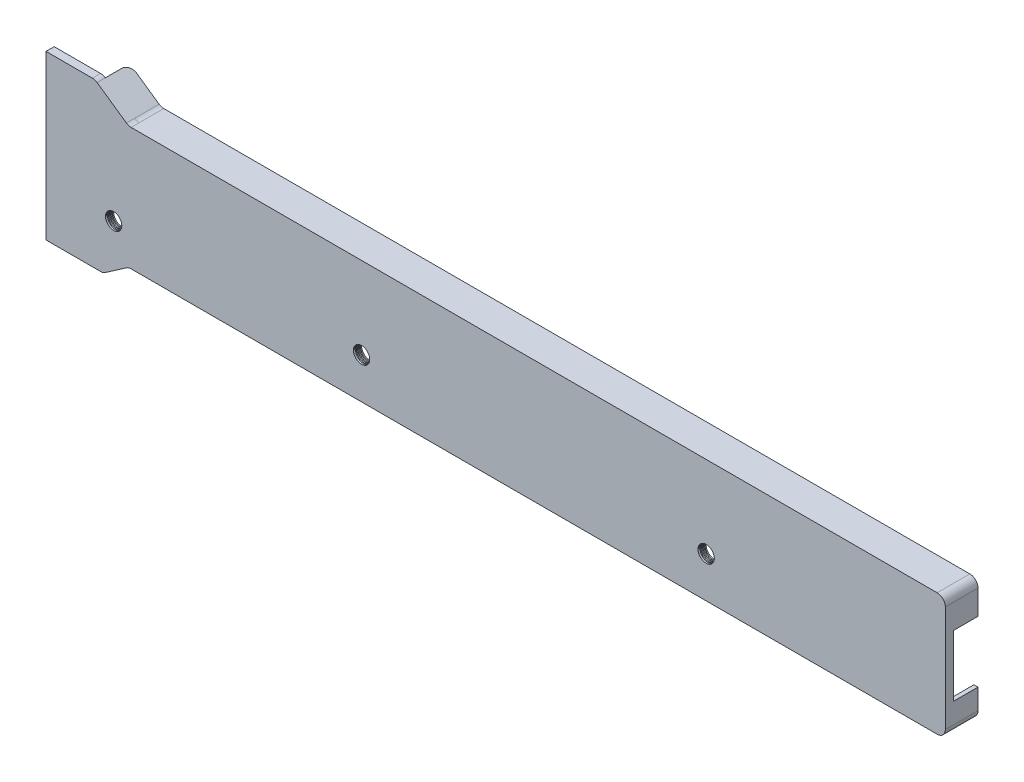
from build123d import *

# Parameters (mm, degrees)
SKETCH_1_W          = 200
SKETCH_1_H          = 30
EXTRUDE_1_DEPTH     = 2
EXTRUDE_2_DEPTH     = 2
FILLET_1_R          = 2
FILLET_2_R          = 2
FILLET_3_R          = 2
SKETCH_6_W          = 8.747928607
SKETCH_6_H          = 0.998948341
EXTRUDE_3_DEPTH     = 1
EXTRUDE_4_DEPTH     = 5
EXTRUDE_6_DEPTH     = 6
FILLET_4_R          = 2
SKETCH_10_W         = 199.373964303
SKETCH_10_H         = 0.996468734
EXTRUDE_7_DEPTH     = 7
SKETCH_11_W         = 6.303856782
SKETCH_11_H         = 2.016283396
EXTRUDE_8_DEPTH     = 1
EXTRUDE_9_DEPTH     = 6
EXTRUDE_10_DEPTH    = 4
SKETCH_14_W         = 5.003531266
SKETCH_14_H         = 7
EXTRUDE_11_DEPTH    = 1
SKETCH_17_W         = 6
SKETCH_17_H         = 6
EXTRUDE_12_DEPTH    = 1
FILLET_5_R          = 2
FILLET_6_R          = 2
SKETCH_18_R         = 2.000568808
CUT_EXTRUDE_1_DEPTH = 3
THREAD_1_PITCH      = 0.5
SKETCH_22_R         = 2.00056881
CUT_EXTRUDE_2_DEPTH = 3
THREAD_3_PITCH      = 0.5
THREAD_4_PITCH      = 0.5


# Read off the part's stored shape, not the designer's step: 填料-伸長6
with BuildPart() as part:
    # Sketch 1 → 填料-伸長1 (new body)
    with BuildSketch(Plane.XY):
        Rectangle(SKETCH_1_W, SKETCH_1_H)
    extrude(amount=EXTRUDE_1_DEPTH)

    # 草圖2 → 填料-伸長2 (add)
    with BuildSketch(Plane.XY):
        Polygon((-100, 15), (-108.215265162, 20.701703106), (-120.21070114, 20.701703106), (-120.21070114, -19.298296894), (-106.21070114, -19.298296894), (-100, -15), align=None)
    extrude(amount=EXTRUDE_2_DEPTH)

    # 圓角1
    fillet_1_edges = [part.edges().sort_by_distance(p)[0] for p in [
        (-100, 15, 1),
    ]]
    fillet(fillet_1_edges, radius=FILLET_1_R)

    # 圓角2
    fillet_2_edges = [part.edges().sort_by_distance(p)[0] for p in [
        (-108.215265162, 20.701703106, 1),
    ]]
    fillet(fillet_2_edges, radius=FILLET_2_R)

    # 圓角3
    fillet_3_edges = [part.edges().sort_by_distance(p)[0] for p in [
        (-106.21070114, -19.298296894, 1),
        (-100, -15, 1),
    ]]
    fillet(fillet_3_edges, radius=FILLET_3_R)

    # 草圖6 → 填料-伸長3 (add)
    with BuildSketch(Plane(origin=(-25.48326788, -36.717415643, 0), x_dir=(0.8215265162225733, -0.5701703106469171, 0), z_dir=(0.5701703106469171, 0.8215265162225733, 0))):
        with Locations((-95.705206282, 0.499474171)):
            Rectangle(SKETCH_6_W, SKETCH_6_H)
    extrude(amount=-EXTRUDE_3_DEPTH)

    # 草圖7 → 填料-伸長4 (add)
    with BuildSketch(Plane(origin=(0, 0, -0.998948341), x_dir=(-1, 0, 0), z_dir=(0, 0, -1))):
        Polygon((107.700960237, 20.344756139), (100.514304925, 15.356946968), (101.084475235, 14.535420451), (108.271130548, 19.523229623), align=None)
    extrude(amount=EXTRUDE_4_DEPTH)

    # 填料-伸長6 outline → 填料-伸長6 (add)
    with BuildSketch(Plane(origin=(0, 0, 0), x_dir=(-1, 0, 0), z_dir=(0, 0, -1))):
        with BuildLine():
            add(Edge.make_bspline(
                [(99.373964303, 15), (99.998694771, 15.004169822), (100.514304925, 15.356946968)],
                knots=[0, 0, 0, 1, 1, 1], degree=2))
            Line((99.373964303, 15), (-100, 15))
            Line((-100, 15), (-100, 14))
            Line((-100, 14), (99.373964303, 14))
            add(Edge.make_bspline(
                [(99.373964303, 14), (99.992630398, 13.901965018), (100.60464568, 14.167438663), (101.084475235, 14.535420451)],
                knots=[0, 0, 0, 0, 1, 1, 1, 1], degree=3))
            Line((101.084475235, 14.535420451), (100.514304925, 15.356946968))
        make_face()
    extrude(amount=EXTRUDE_6_DEPTH)

    # 圓角4
    fillet_4_edges = [part.edges().sort_by_distance(p)[0] for p in [
        (-107.986045393, 19.933992881, -5.998948341),
    ]]
    fillet(fillet_4_edges, radius=FILLET_4_R)

    # 草圖10 → 填料-伸長7 (add)
    with BuildSketch(Plane.XZ.offset(-14)):
        with Locations((0.313017848, -5.501765633)):
            Rectangle(SKETCH_10_W, SKETCH_10_H)
    extrude(amount=EXTRUDE_7_DEPTH)

    # 草圖11 → 填料-伸長8 (add)
    with BuildSketch(Plane(origin=(-25.366355982, 36.652390449, 0), x_dir=(0.8222801231869686, 0.569082945634135, 0), z_dir=(0.569082945634135, -0.8222801231869686, 0))):
        with Locations((-94.540768281, -1.008141698)):
            Rectangle(SKETCH_11_W, SKETCH_11_H)
    extrude(amount=-EXTRUDE_8_DEPTH)

    # 草圖12 → 填料-伸長9 (add)
    with BuildSketch(Plane(origin=(0, 0, 0), x_dir=(-1, 0, 0), z_dir=(0, 0, -1))):
        with BuildLine():
            Line((-100, -15), (-100, -14.004330621))
            Line((-100, -14.004330621), (99.375416613, -14.004330621))
            add(Edge.make_bspline(
                [(99.375416613, -14.004330621), (99.97630066, -13.942433073), (100.662715374, -14.050478699), (101.08266545, -14.53315963)],
                knots=[0, 0, 0, 0, 1, 1, 1, 1], degree=3))
            Line((101.08266545, -14.53315963), (100.513582504, -15.355439754))
            add(Edge.make_bspline(
                [(99.375416613, -15), (99.998709034, -15.004133847), (100.513582504, -15.355439754)],
                knots=[0, 0, 0, 1, 1, 1], degree=2))
            Line((99.375416613, -15), (-100, -15))
        make_face()
    extrude(amount=EXTRUDE_9_DEPTH)

    # 草圖13 → 填料-伸長10 (add)
    with BuildSketch(Plane(origin=(0, 0, -2.016283396), x_dir=(-1, 0, 0), z_dir=(0, 0, -1))):
        Polygon((101.08266545, -14.53315963), (100.513582504, -15.355439754), (105.697118635, -18.94285714), (106.266201581, -18.120577017), align=None)
    extrude(amount=EXTRUDE_10_DEPTH)

    # 草圖14 → 填料-伸長11 (add)
    with BuildSketch(Plane(origin=(100, 0, 0), x_dir=(0, 0, -1), z_dir=(1, 0, 0))):
        with Locations((2.501765633, 10.5)):
            Rectangle(SKETCH_14_W, SKETCH_14_H)
    extrude(amount=-EXTRUDE_11_DEPTH)

    # 草圖17 → 填料-伸長12 (add)
    with BuildSketch(Plane(origin=(100, 0, 0), x_dir=(0, 0, -1), z_dir=(1, 0, 0))):
        with Locations((3, -11.004330621)):
            Rectangle(SKETCH_17_W, SKETCH_17_H)
    extrude(amount=-EXTRUDE_12_DEPTH)

    # 圓角5
    fillet_5_edges = [part.edges().sort_by_distance(p)[0] for p in [
        (100, 15, -2),
    ]]
    fillet(fillet_5_edges, radius=FILLET_5_R)

    # 圓角6
    fillet_6_edges = [part.edges().sort_by_distance(p)[0] for p in [
        (100, -15, -2),
    ]]
    fillet(fillet_6_edges, radius=FILLET_6_R)

    # 草圖18 → 除料-伸長1 (cut)
    with BuildSketch(Plane(origin=(0, 0, 0), x_dir=(-1, 0, 0), z_dir=(0, 0, -1))):
        with Locations((103.649944561, -6.992570147)):
            Circle(SKETCH_18_R)
    extrude(amount=-CUT_EXTRUDE_1_DEPTH, mode=Mode.SUBTRACT)

    # 螺紋1: the profile of Sketch 1 2 profile screwed along a right-hand helix of 20 turns, 6 arcs to a turn; built about Z, then put on its axis
    thread_1_z = Axis((0, 0, 0), (0, 0, 1))
    thread_1_corners = [(2.000268808, 0, -0.000173205), (2.172420723, 0, 0.09921875), (2.172420723, 0, 0.13890625), (2.000268808, 0, 0.238298204)]
    with BuildLine(mode=Mode.PRIVATE) as thread_1_profile:
        Line(thread_1_corners[0], thread_1_corners[1])
        Line(thread_1_corners[1], thread_1_corners[2])
        Line(thread_1_corners[2], thread_1_corners[3])
        Line(thread_1_corners[3], thread_1_corners[0])
    thread_1_cap = Face(thread_1_profile.wire())
    thread_1_turn_angles = [0, 30, 60, 90, 120, 150, 180, 210, 240, 270, 300, 330, 360]
    thread_1_turn_weights = [1, 0.8660254037844387, 1, 0.8660254037844387, 1, 0.8660254037844387, 1, 0.8660254037844387, 1, 0.8660254037844387, 1, 0.8660254037844387, 1]
    thread_1_turn_rails = [Edge.make_bspline([Vector(p[0], p[1], 0).rotate(thread_1_z, thread_1_turn_angles[k]) / thread_1_turn_weights[k] + Vector(0, 0, p[2] + THREAD_1_PITCH * thread_1_turn_angles[k] / 360) for k in range(13)], [0, 0, 0, 1, 1, 2, 2, 3, 3, 4, 4, 5, 5, 6, 6, 6], 2, thread_1_turn_weights) for p in thread_1_corners]
    thread_1_turn_sides = [Face.make_surface_from_curves(thread_1_turn_rails[p[0]], thread_1_turn_rails[p[1]]) for p in [(0, 1), (1, 2), (2, 3), (3, 0)]]
    thread_1 = Plane(origin=(-103.649944561, -6.992570147, 2), x_dir=(-1, 0, 0), z_dir=(0, 0, -1)) * Solid(Shell([*[p.moved(Location((0, 0, THREAD_1_PITCH * i))) for i in range(20) for p in thread_1_turn_sides], thread_1_cap, thread_1_cap.rotate(thread_1_z, 7200).moved(Location((0, 0, THREAD_1_PITCH * 7200 / 360)))]))
    add(thread_1, mode=Mode.SUBTRACT)

    # 草圖22 → 除料-伸長2 (cut)
    with BuildSketch(Plane.XY.offset(2)):
        with Locations((41.426627634, -5.025539325)):
            Circle(SKETCH_22_R)
        with Locations((-42.939263834, -5.027581415)):
            Circle(SKETCH_22_R)
    extrude(amount=-CUT_EXTRUDE_2_DEPTH, mode=Mode.SUBTRACT)

    # 螺紋3: the profile of 螺紋輪廓4 profile screwed along a right-hand helix of 20 turns, 6 arcs to a turn; built about Z, then put on its axis
    thread_3_z = Axis((0, 0, 0), (0, 0, 1))
    thread_3_corners = [(2.00026881, 0, -0.000173205), (2.172420725, 0, 0.09921875), (2.172420725, 0, 0.13890625), (2.00026881, 0, 0.238298204)]
    with BuildLine(mode=Mode.PRIVATE) as thread_3_profile:
        Line(thread_3_corners[0], thread_3_corners[1])
        Line(thread_3_corners[1], thread_3_corners[2])
        Line(thread_3_corners[2], thread_3_corners[3])
        Line(thread_3_corners[3], thread_3_corners[0])
    thread_3_cap = Face(thread_3_profile.wire())
    thread_3_turn_angles = [0, 30, 60, 90, 120, 150, 180, 210, 240, 270, 300, 330, 360]
    thread_3_turn_weights = [1, 0.8660254037844387, 1, 0.8660254037844387, 1, 0.8660254037844387, 1, 0.8660254037844387, 1, 0.8660254037844387, 1, 0.8660254037844387, 1]
    thread_3_turn_rails = [Edge.make_bspline([Vector(p[0], p[1], 0).rotate(thread_3_z, thread_3_turn_angles[k]) / thread_3_turn_weights[k] + Vector(0, 0, p[2] + THREAD_3_PITCH * thread_3_turn_angles[k] / 360) for k in range(13)], [0, 0, 0, 1, 1, 2, 2, 3, 3, 4, 4, 5, 5, 6, 6, 6], 2, thread_3_turn_weights) for p in thread_3_corners]
    thread_3_turn_sides = [Face.make_surface_from_curves(thread_3_turn_rails[p[0]], thread_3_turn_rails[p[1]]) for p in [(0, 1), (1, 2), (2, 3), (3, 0)]]
    thread_3 = Plane(origin=(-42.939263834, -5.027581415, 2), x_dir=(-1, 0, 0), z_dir=(0, 0, -1)) * Solid(Shell([*[p.moved(Location((0, 0, THREAD_3_PITCH * i))) for i in range(20) for p in thread_3_turn_sides], thread_3_cap, thread_3_cap.rotate(thread_3_z, 7200).moved(Location((0, 0, THREAD_3_PITCH * 7200 / 360)))]))
    add(thread_3, mode=Mode.SUBTRACT)

    # 螺紋4: the profile of 螺紋輪廓5 profile screwed along a right-hand helix of 20 turns, 6 arcs to a turn; built about Z, then put on its axis
    thread_4_z = Axis((0, 0, 0), (0, 0, 1))
    thread_4_corners = [(2.00026881, 0, -0.000173205), (2.172420725, 0, 0.09921875), (2.172420725, 0, 0.13890625), (2.00026881, 0, 0.238298204)]
    with BuildLine(mode=Mode.PRIVATE) as thread_4_profile:
        Line(thread_4_corners[0], thread_4_corners[1])
        Line(thread_4_corners[1], thread_4_corners[2])
        Line(thread_4_corners[2], thread_4_corners[3])
        Line(thread_4_corners[3], thread_4_corners[0])
    thread_4_cap = Face(thread_4_profile.wire())
    thread_4_turn_angles = [0, 30, 60, 90, 120, 150, 180, 210, 240, 270, 300, 330, 360]
    thread_4_turn_weights = [1, 0.8660254037844387, 1, 0.8660254037844387, 1, 0.8660254037844387, 1, 0.8660254037844387, 1, 0.8660254037844387, 1, 0.8660254037844387, 1]
    thread_4_turn_rails = [Edge.make_bspline([Vector(p[0], p[1], 0).rotate(thread_4_z, thread_4_turn_angles[k]) / thread_4_turn_weights[k] + Vector(0, 0, p[2] + THREAD_4_PITCH * thread_4_turn_angles[k] / 360) for k in range(13)], [0, 0, 0, 1, 1, 2, 2, 3, 3, 4, 4, 5, 5, 6, 6, 6], 2, thread_4_turn_weights) for p in thread_4_corners]
    thread_4_turn_sides = [Face.make_surface_from_curves(thread_4_turn_rails[p[0]], thread_4_turn_rails[p[1]]) for p in [(0, 1), (1, 2), (2, 3), (3, 0)]]
    thread_4 = Plane(origin=(41.426627634, -5.025539325, 2), x_dir=(-1, 0, 0), z_dir=(0, 0, -1)) * Solid(Shell([*[p.moved(Location((0, 0, THREAD_4_PITCH * i))) for i in range(20) for p in thread_4_turn_sides], thread_4_cap, thread_4_cap.rotate(thread_4_z, 7200).moved(Location((0, 0, THREAD_4_PITCH * 7200 / 360)))]))
    add(thread_4, mode=Mode.SUBTRACT)


solid = part.part
